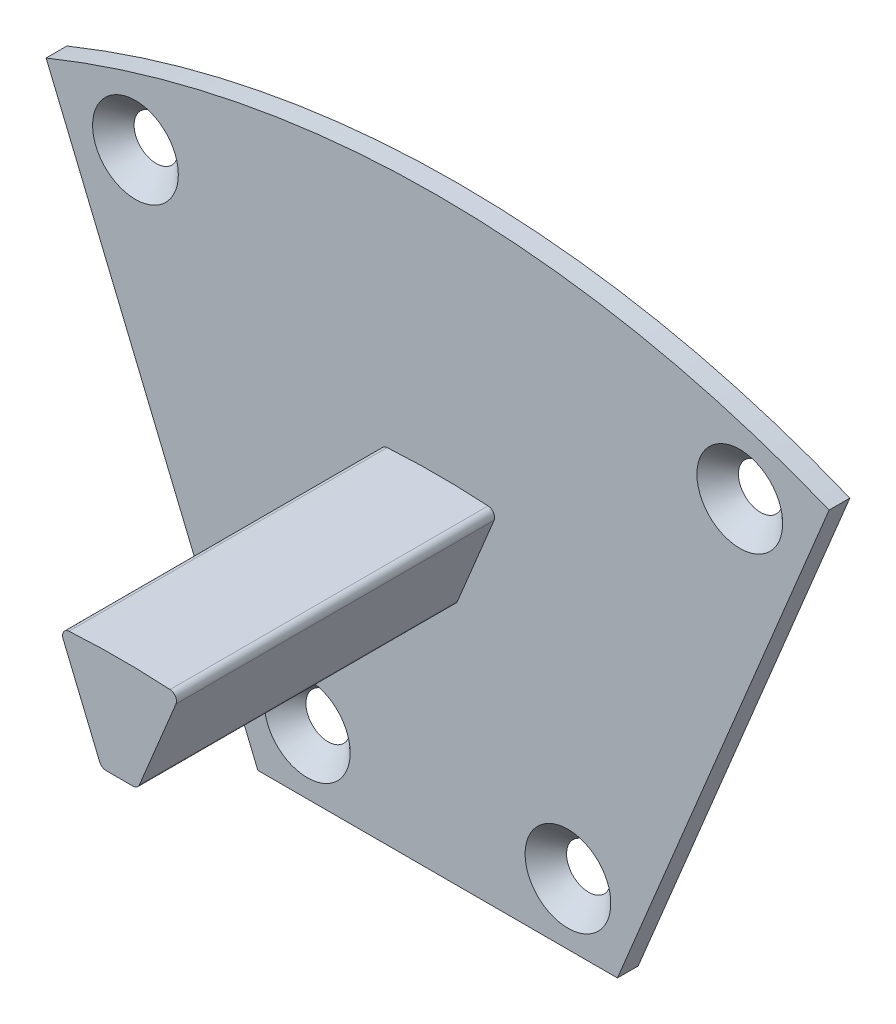
from build123d import *

# Parameters (mm, degrees)
BOSS_EXTRUDE1_DEPTH = 23
SKETCH5_R           = 1.6
BOSS_EXTRUDE2_DEPTH = 1.5
CHAMFER1_SIZE       = 1.5


with BuildPart() as part:
    # Sketch1 → Boss-Extrude1 (new body)
    with BuildSketch(Plane.XY):
        with BuildLine():
            Line((-4.081066361, 56.693646837), (-1.434724284, 50.304811902))
            ThreePointArc((-1.434724284, 50.304811902), (-1.250569634, 50.080418812), (-0.972784517, 49.996153619))
            Line((-0.972784517, 49.996153619), (0.972784517, 49.996153619))
            ThreePointArc((0.972784517, 49.996153619), (1.250569634, 50.080418812), (1.434724284, 50.304811902))
            Line((1.434724284, 50.304811902), (4.081066361, 56.693646837))
            ThreePointArc((4.081066361, 56.693646837), (4.043474856, 57.149428628), (3.65087332, 57.383979681))
            ThreePointArc((3.65087332, 57.383979681), (0, 57.5), (-3.65087332, 57.383979681))
            ThreePointArc((-3.65087332, 57.383979681), (-4.043474856, 57.149428628), (-4.081066361, 56.693646837))
        make_face()
    extrude(amount=-BOSS_EXTRUDE1_DEPTH)

    # Sketch5 → Boss-Extrude2 (add)
    with BuildSketch(Plane(origin=(0, 0, -23), x_dir=(-1, 0, 0), z_dir=(0, 0, -1))):
        with BuildLine():
            Line((-28.307864731, 69.452608262), (-13, 32.496153619))
            Line((-13, 32.496153619), (13, 32.496153619))
            Line((13, 32.496153619), (28.307864731, 69.452608262))
            ThreePointArc((28.307864731, 69.452608262), (0, 75), (-28.307864731, 69.452608262))
        make_face()
        with Locations((-21.848934107, 66.925)):
            Circle(SKETCH5_R, mode=Mode.SUBTRACT)
        with Locations(Location((21.848934107, 66.925, 0), (0, 0, 180))):
            Circle(SKETCH5_R, mode=Mode.SUBTRACT)
        with Locations((-9.422527235, 36.925)):
            Circle(SKETCH5_R, mode=Mode.SUBTRACT)
        with Locations(Location((9.422527235, 36.925, 0), (0, 0, 180))):
            Circle(SKETCH5_R, mode=Mode.SUBTRACT)
    extrude(amount=BOSS_EXTRUDE2_DEPTH)

    # Chamfer1
    chamfer1_edges = [part.edges().sort_by_distance(p)[0] for p in [
        (23.448934107, 66.925, -23),
        (-23.448934107, 66.925, -23),
        (11.022527235, 36.925, -23),
        (-11.022527235, 36.925, -23),
    ]]
    chamfer(chamfer1_edges, length=CHAMFER1_SIZE - 0.0001)  # a hair under: the kernel refuses the full size


solid = part.part
